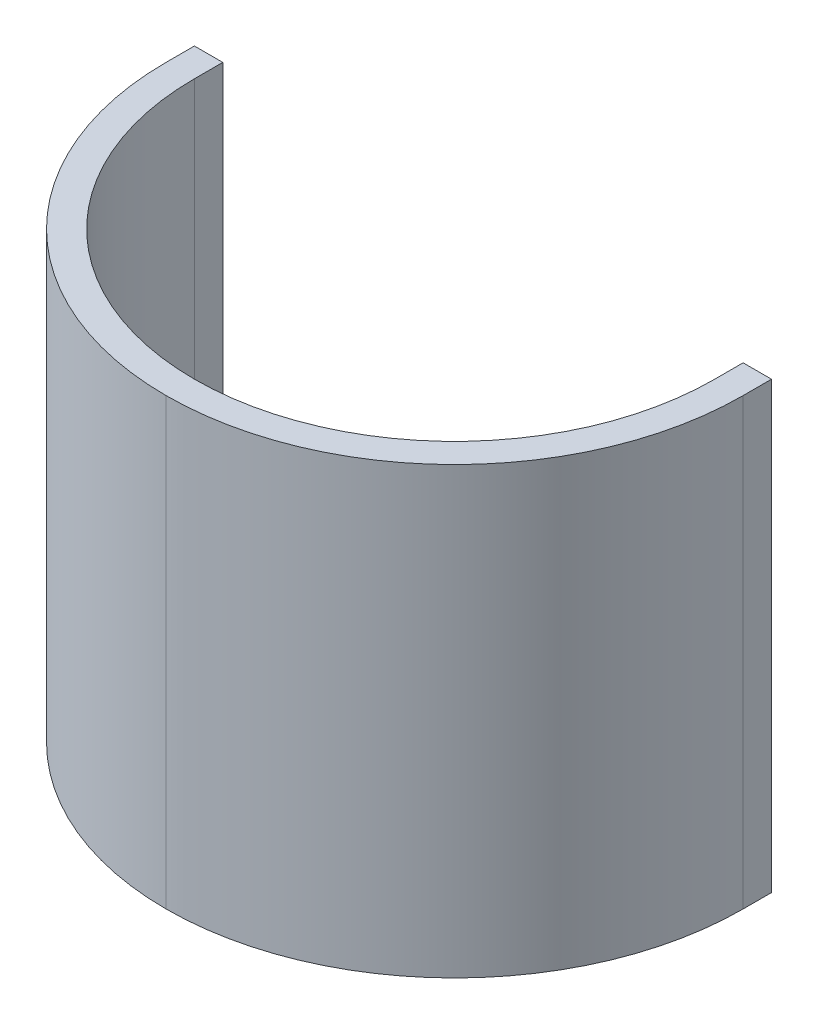
from build123d import *

# Parameters (mm, degrees)
SKETCH_1_W          = 61
SKETCH_1_H          = 33.5
EXTRUDE_1_DEPTH     = 50
SKETCH_2_W          = 55
SKETCH_2_H          = 44
CUT_EXTRUDE_1_DEPTH = 30.5
FILLET_3_R          = 27.5
FILLET_4_R          = 30.5
SKETCH_3_R          = 23.5
CUT_EXTRUDE_2_DEPTH = 30.5
SKETCH_5_R          = 16
CUT_EXTRUDE_4_DEPTH = 30.5
FILLET_5_R          = 4
FILLET_6_R          = 2
SKETCH_6_W          = 61
SKETCH_6_H          = 3
CUT_EXTRUDE_5_DEPTH = 400


with BuildPart() as part:
    # 스케치1 → 보스-돌출1 (new body)
    with BuildSketch(Plane(origin=(0, 0, 0), x_dir=(1, 0, 0), z_dir=(0, 1, 0))):
        Rectangle(SKETCH_1_W, SKETCH_1_H)
    extrude(amount=EXTRUDE_1_DEPTH)

    # 스케치2 → 컷-돌출1 (cut)
    with BuildSketch(Plane(origin=(0, 0, -16.75), x_dir=(-1, 0, 0), z_dir=(0, 0, -1))):
        with Locations((0, 25)):
            Rectangle(SKETCH_2_W, SKETCH_2_H)
    extrude(amount=-CUT_EXTRUDE_1_DEPTH, mode=Mode.SUBTRACT)

    # 필렛3
    fillet_3_edges = [part.edges().sort_by_distance(p)[0] for p in [
        (-27.5, 25, 13.75),
        (27.5, 25, 13.75),
    ]]
    fillet(fillet_3_edges, radius=FILLET_3_R - 0.0001)  # a hair under: the kernel refuses the full size

    # 필렛4
    fillet_4_edges = [part.edges().sort_by_distance(p)[0] for p in [
        (-30.5, 25, 16.75),
        (30.5, 25, 16.75),
    ]]
    fillet(fillet_4_edges, radius=FILLET_4_R - 0.0001)  # a hair under: the kernel refuses the full size

    # 스케치3 → 컷-돌출2 (cut)
    with BuildSketch(Plane.XZ):
        with Locations((0, -13.75)):
            Circle(SKETCH_3_R)
    extrude(amount=-CUT_EXTRUDE_2_DEPTH, mode=Mode.SUBTRACT)

    # 스케치5 → 컷-돌출4 (cut)
    with BuildSketch(Plane.XZ.offset(-47)):
        with Locations((0, -13.75)):
            Circle(SKETCH_5_R)
    extrude(amount=-CUT_EXTRUDE_4_DEPTH, mode=Mode.SUBTRACT)

    # 필렛5
    fillet_5_edges = [part.edges().sort_by_distance(p)[0] for p in [
        (-15.716233646, 48.5, -16.75),
        (15.716233646, 48.5, -16.75),
    ]]
    fillet(fillet_5_edges, radius=FILLET_5_R)

    # 필렛6
    fillet_6_edges = [part.edges().sort_by_distance(p)[0] for p in [
        (-23.307724042, 1.5, -16.75),
        (23.307724042, 1.5, -16.75),
    ]]
    fillet(fillet_6_edges, radius=FILLET_6_R)

    # 스케치6 → 컷-돌출5 (cut)
    with BuildSketch(Plane(origin=(0, 0, -16.75), x_dir=(-1, 0, 0), z_dir=(0, 0, -1))):
        with Locations((0, 48.5)):
            Rectangle(SKETCH_6_W, SKETCH_6_H)
    extrude(amount=-CUT_EXTRUDE_5_DEPTH, mode=Mode.SUBTRACT)


solid = part.part
